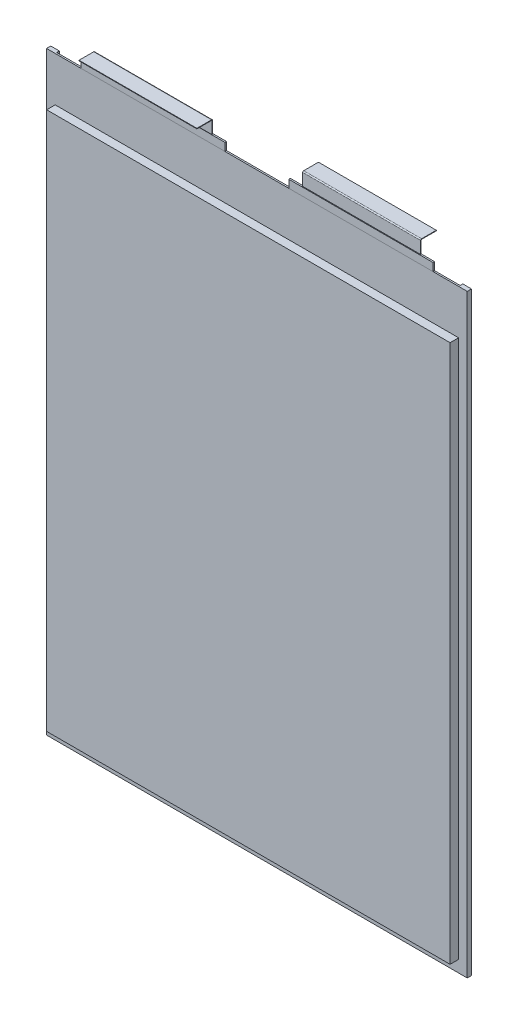
from build123d import *

# Parameters (mm, degrees)
INSULATION_DEPTH      = 0.3
INSULATION_DEPTH_BACK = 0.3
SKETCH1_W             = 160.6
SKETCH1_H             = 227
MAIN_BODY_DEPTH       = 3.55
MAIN_BODY_DEPTH_BACK  = 3.55
SKETCH2_W             = 154
SKETCH2_H             = 205.5
SIDE_FOLDS_DEPTH      = 1.016
SKETCH114_W           = 55
SKETCH114_H           = 0.6
BOSS_EXTRUDE1_DEPTH   = 3
BOSS_EXTRUDE1_2_DEPTH = 3
BASE_FLANGE1_DEPTH    = 45
BASE_FLANGE2_DEPTH    = 45


# Sheet-metal steps are written as plain solids
with BuildPart() as part:
    # Sketch1 → Insulation (new, two sides: drawn at the far end of the back side and taken through both)
    with BuildSketch(Plane.XY.offset(-INSULATION_DEPTH_BACK)):
        Rectangle(SKETCH1_W, SKETCH1_H)
    extrude(amount=INSULATION_DEPTH + INSULATION_DEPTH_BACK)

    # Sketch2 → Main Body (add, two sides: drawn at the far end of the back side and taken through both)
    with BuildSketch(Plane.XY.offset(-MAIN_BODY_DEPTH_BACK)):
        with Locations((0, -6.25)):
            Rectangle(SKETCH2_W, SKETCH2_H)
    extrude(amount=MAIN_BODY_DEPTH + MAIN_BODY_DEPTH_BACK)

    # Sketch5 → Side Folds (add)
    with BuildSketch(Plane(origin=(0, 0, -0.3), x_dir=(-1, 0, 0), z_dir=(0, 0, -1))):
        Polygon((-77, -109), (-77, 96.5), (-77, 113.5), (-80.3, 113.5), (-80.3, -113.5), (-77, -113.5), align=None)
        Polygon((77, 113.5), (77, 96.5), (77, -109), (77, -113.5), (80.3, -113.5), (80.3, 113.5), align=None)
    extrude(amount=SIDE_FOLDS_DEPTH)


with BuildPart() as body_2:
    # Sketch114 → Boss-Extrude1 (new body)
    with BuildSketch(Plane(origin=(0, 113.5, 0), x_dir=(1, 0, 0), z_dir=(0, 1, 0))):
        with Locations((-39.7, 0)):
            Rectangle(SKETCH114_W, SKETCH114_H)
    extrude(amount=BOSS_EXTRUDE1_DEPTH)


with BuildPart() as body_3:
    # Sketch114 → Boss-Extrude1 2 (new body)
    with BuildSketch(Plane(origin=(0, 113.5, 0), x_dir=(1, 0, 0), z_dir=(0, 1, 0))):
        with Locations((39.7, 0)):
            Rectangle(SKETCH114_W, SKETCH114_H)
    extrude(amount=BOSS_EXTRUDE1_2_DEPTH)


with BuildPart() as body_4:
    # Sketch115 → Base-Flange1 (new body)
    with BuildSketch(Plane.ZY.offset(62.2)):
        with BuildLine():
            Line((0, 116.5), (0, 121.1))
            ThreePointArc((0, 121.1), (0.117157288, 121.382842712), (0.4, 121.5))
            Line((0.4, 121.5), (6, 121.5))
            Line((6, 121.5), (6, 121.3))
            Line((6, 121.3), (0.4, 121.3))
            ThreePointArc((0.4, 121.3), (0.258578644, 121.241421356), (0.2, 121.1))
            Line((0.2, 121.1), (0.2, 116.5))
            Line((0.2, 116.5), (0, 116.5))
        make_face()
    extrude(amount=-BASE_FLANGE1_DEPTH)


with BuildPart() as body_5:
    # Sketch120 → Base-Flange2 (new body)
    with BuildSketch(Plane(origin=(62.2, 0, 0), x_dir=(0, 0, -1), z_dir=(1, 0, 0))):
        with BuildLine():
            Line((0, 116.5), (0, 121.1))
            ThreePointArc((0, 121.1), (0.117157288, 121.382842712), (0.4, 121.5))
            Line((0.4, 121.5), (6, 121.5))
            Line((6, 121.5), (6, 121.3))
            Line((6, 121.3), (0.4, 121.3))
            ThreePointArc((0.4, 121.3), (0.258578644, 121.241421356), (0.2, 121.1))
            Line((0.2, 121.1), (0.2, 116.5))
            Line((0.2, 116.5), (0, 116.5))
        make_face()
    extrude(amount=-BASE_FLANGE2_DEPTH)


solid = Compound([part.part, body_2.part, body_3.part, body_4.part, body_5.part])
